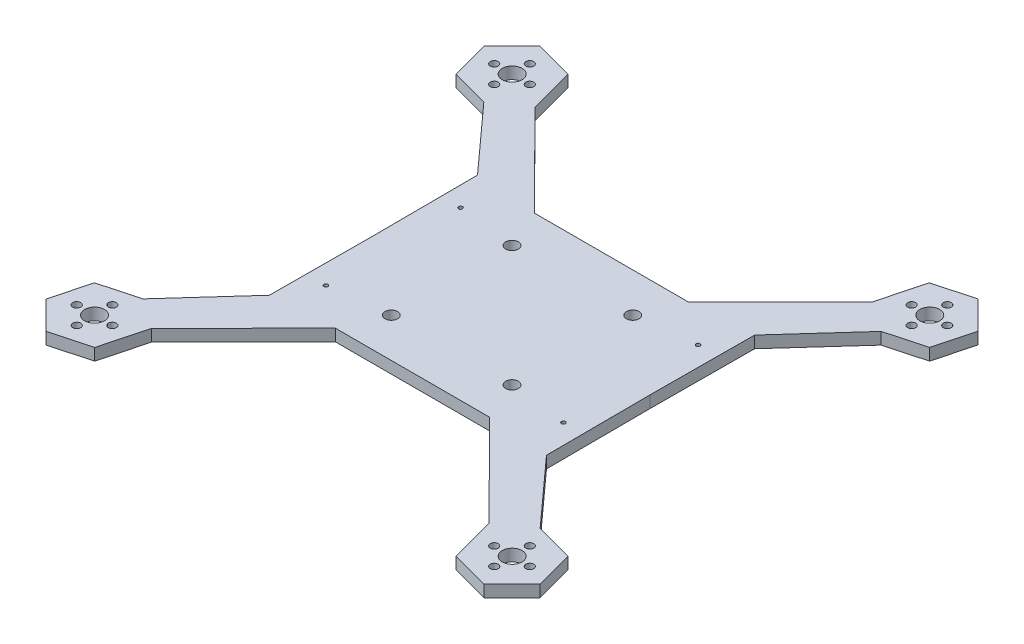
from build123d import *

# Parameters (mm, degrees)
SKETCH1_R           = 1
SKETCH1_R_2         = 0.5
SKETCH1_R_3         = 1.6
BOSS_EXTRUDE1_DEPTH = 3
SKETCH7_R           = 0.75
BOSS_EXTRUDE4_DEPTH = 0.05
SKETCH8_R           = 2.5
CUT_EXTRUDE7_DEPTH  = 10


with BuildPart() as part:
    # Sketch1 → Boss-Extrude1 (new body)
    with BuildSketch(Plane(origin=(0, 0, 0), x_dir=(1, 0, 0), z_dir=(0, 1, 0))):
        Polygon((43.076410298, 50.123925917), (42.618597625, 48.402115535), (19.4637773, 25.158118275), (-19.4637773, 25.158118275), (-42.618597625, 48.402115535), (-45.64603124, 59.788140743), (-55.300297258, 62.394891143), (-62.384942335, 55.337426715), (-59.815321393, 45.673211889), (-50.185022628, 43.072932893), (-35, 26.288270568), (-34.873, 0), (-35, -26.288270568), (-50.185022628, -43.072932893), (-59.815321393, -45.673211889), (-62.384942335, -55.337426715), (-55.300297258, -62.394891143), (-45.64603124, -59.788140743), (-42.618597625, -48.402115535), (-19.4637773, -25.158118275), (19.4637773, -25.158118275), (42.618597625, -48.402115535), (45.64603124, -59.788140743), (55.300297258, -62.394891143), (62.384942335, -55.337426715), (59.815321393, -45.673211889), (50.185022628, -43.072932893), (35, -26.288270568), (34.873, 0), (35, 26.288270568), (50.185022628, 43.072932893), (59.815321393, 45.673211889), (62.384942335, 55.337426715), (55.300297258, 62.394891143), (45.64603124, 59.788140743), align=None)
        with Locations((-52.730676316, -57.230676316)):
            Circle(SKETCH1_R, mode=Mode.SUBTRACT)
        with Locations((-57.230676316, -52.730676316)):
            Circle(SKETCH1_R, mode=Mode.SUBTRACT)
        with Locations((-48.230676316, -52.730676316)):
            Circle(SKETCH1_R, mode=Mode.SUBTRACT)
        with Locations((-52.730676316, -48.230676316)):
            Circle(SKETCH1_R, mode=Mode.SUBTRACT)
        with Locations((-30, -17)):
            Circle(SKETCH1_R_2, mode=Mode.SUBTRACT)
        with Locations((-15.25, -15.25)):
            Circle(SKETCH1_R_3, mode=Mode.SUBTRACT)
        with Locations((52.730676316, -57.230676316)):
            Circle(SKETCH1_R, mode=Mode.SUBTRACT)
        with Locations((48.230676316, -52.730676316)):
            Circle(SKETCH1_R, mode=Mode.SUBTRACT)
        with Locations((52.730676316, -48.230676316)):
            Circle(SKETCH1_R, mode=Mode.SUBTRACT)
        with Locations((57.230676316, -52.730676316)):
            Circle(SKETCH1_R, mode=Mode.SUBTRACT)
        with Locations((30, -17)):
            Circle(SKETCH1_R_2, mode=Mode.SUBTRACT)
        with Locations((15.25, -15.25)):
            Circle(SKETCH1_R_3, mode=Mode.SUBTRACT)
        with Locations((-15.25, 15.25)):
            Circle(SKETCH1_R_3, mode=Mode.SUBTRACT)
        with Locations((-30, 17)):
            Circle(SKETCH1_R_2, mode=Mode.SUBTRACT)
        with Locations((-57.230676316, 52.730676316)):
            Circle(SKETCH1_R, mode=Mode.SUBTRACT)
        with Locations((-52.730676316, 48.230676316)):
            Circle(SKETCH1_R, mode=Mode.SUBTRACT)
        with Locations((-48.230676316, 52.730676316)):
            Circle(SKETCH1_R, mode=Mode.SUBTRACT)
        with Locations((-52.730676316, 57.230676316)):
            Circle(SKETCH1_R, mode=Mode.SUBTRACT)
        with Locations((15.25, 15.25)):
            Circle(SKETCH1_R_3, mode=Mode.SUBTRACT)
        with Locations((30, 17)):
            Circle(SKETCH1_R_2, mode=Mode.SUBTRACT)
        with Locations((52.730676316, 48.230676316)):
            Circle(SKETCH1_R, mode=Mode.SUBTRACT)
        with Locations((48.230676316, 52.730676316)):
            Circle(SKETCH1_R, mode=Mode.SUBTRACT)
        with Locations((57.230676316, 52.730676316)):
            Circle(SKETCH1_R, mode=Mode.SUBTRACT)
        with Locations((52.730676316, 57.230676316)):
            Circle(SKETCH1_R, mode=Mode.SUBTRACT)
    extrude(amount=BOSS_EXTRUDE1_DEPTH)

    # Sketch7 → Boss-Extrude4 (add)
    with BuildSketch(Plane(origin=(0, 3, 0), x_dir=(1, 0, 0), z_dir=(0, 1, 0))):
        with Locations((-52.730676316, -52.730676316)):
            Circle(SKETCH7_R)
        with Locations((-52.730676316, 52.730676316)):
            Circle(SKETCH7_R)
        with Locations((52.730676316, 52.730676316)):
            Circle(SKETCH7_R)
        with Locations((52.730676316, -52.730676316)):
            Circle(SKETCH7_R)
    extrude(amount=BOSS_EXTRUDE4_DEPTH)

    # Sketch8 → Cut-Extrude7 (cut)
    with BuildSketch(Plane(origin=(0, 3, 0), x_dir=(1, 0, 0), z_dir=(0, 1, 0))):
        with Locations((-52.730676316, -52.730676316)):
            Circle(SKETCH8_R)
        with Locations((52.769323684, -52.730676316)):
            Circle(SKETCH8_R)
        with Locations((52.769323684, 52.769323684)):
            Circle(SKETCH8_R)
        with Locations((-52.730676316, 52.769323684)):
            Circle(SKETCH8_R)
    extrude(amount=-CUT_EXTRUDE7_DEPTH, mode=Mode.SUBTRACT)


with BuildPart() as body_2:
    # of the pieces the cut leaves, the one that is kept (cut_extrude7_keep)
    add(part.part.solids().sort_by_distance((-19.4637773, 0, 25.158118275))[0])


solid = body_2.part
